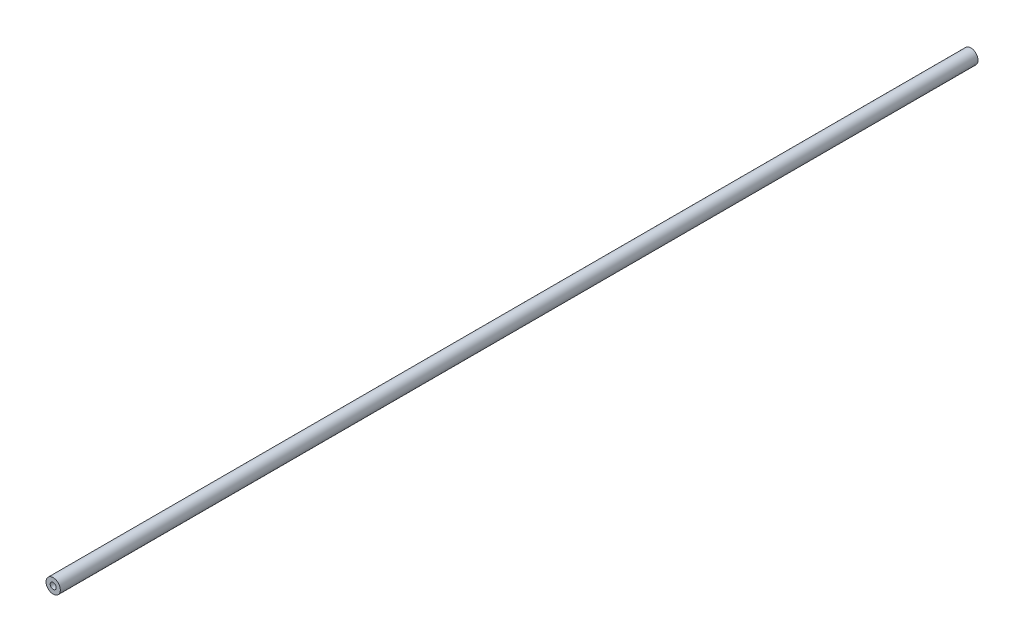
from build123d import *

# Parameters (mm, degrees)
SKETCH1_R                            = 4.7625
BOSS_EXTRUDE1_DEPTH                  = 304.8
F_10_32_TAPPED_HOLE1_D               = 4.0386
F_10_32_TAPPED_HOLE1_DEPTH           = 12.02944
F_10_32_TAPPED_HOLE1_TIP             = 1.213317848
F_10_32_TAPPED_HOLE1_ON_FACE_2_D     = 4.0386
F_10_32_TAPPED_HOLE1_ON_FACE_2_DEPTH = 12.02944
F_10_32_TAPPED_HOLE1_ON_FACE_2_TIP   = 1.213317848


with BuildPart() as part:
    # Sketch1 → Boss-Extrude1 (new, symmetric)
    with BuildSketch(Plane.XY):
        Circle(SKETCH1_R)
    extrude(amount=BOSS_EXTRUDE1_DEPTH, both=True)

    # #10-32 Tapped Hole1
    with Locations(Plane(origin=(0, 0, -304.8), x_dir=(-1, 0, 0), z_dir=(0, 0, -1))):
        with Locations((0, 0)):
            Hole(F_10_32_TAPPED_HOLE1_D / 2, depth=F_10_32_TAPPED_HOLE1_DEPTH)
            with Locations((0, 0, -(F_10_32_TAPPED_HOLE1_DEPTH + F_10_32_TAPPED_HOLE1_TIP / 2))):  # 118° drill point
                Cone(0, F_10_32_TAPPED_HOLE1_D / 2, F_10_32_TAPPED_HOLE1_TIP, mode=Mode.SUBTRACT)

    # #10-32 Tapped Hole1 on face 2
    with Locations(Plane.XY.offset(304.8)):
        with Locations((0, 0)):
            Hole(F_10_32_TAPPED_HOLE1_ON_FACE_2_D / 2, depth=F_10_32_TAPPED_HOLE1_ON_FACE_2_DEPTH)
            with Locations((0, 0, -(F_10_32_TAPPED_HOLE1_ON_FACE_2_DEPTH + F_10_32_TAPPED_HOLE1_ON_FACE_2_TIP / 2))):  # 118° drill point
                Cone(0, F_10_32_TAPPED_HOLE1_ON_FACE_2_D / 2, F_10_32_TAPPED_HOLE1_ON_FACE_2_TIP, mode=Mode.SUBTRACT)


solid = part.part
